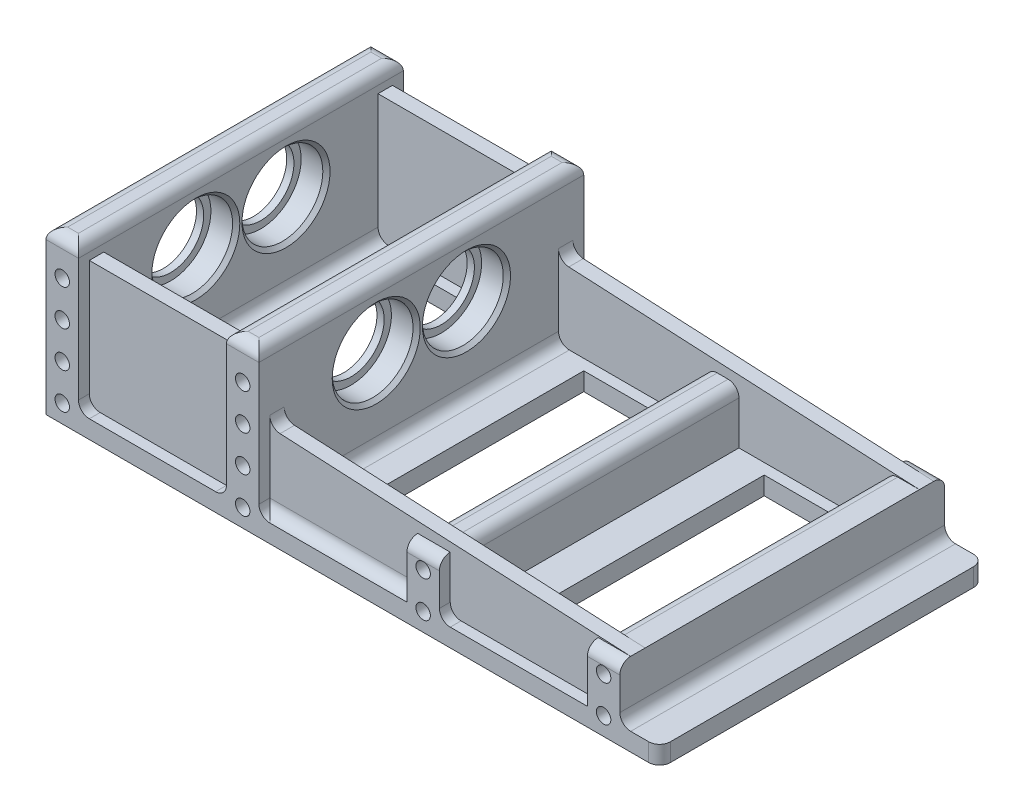
from build123d import *

# Parameters (mm, degrees)
ESQUISSE1_W             = 170
ESQUISSE1_H             = 90
BOSS_EXTRU_1_DEPTH      = 5
ESQUISSE2_W             = 9
ESQUISSE2_H             = 90
BOSS_EXTRU_2_DEPTH      = 40
ESQUISSE3_R             = 11.2
ENL_V_MAT_EXTRU_2_DEPTH = 22.5
ESQUISSE3_4_R           = 11.2
ENL_V_MAT_EXTRU_3_DEPTH = 178.842727722
ESQUISSE5_W             = 21
ESQUISSE5_H             = 70
ENL_V_MAT_EXTRU_4_DEPTH = 129.791553366
ESQUISSE18_W            = 9
ESQUISSE18_H            = 90
BOSS_EXTRU_8_DEPTH      = 15
NERVURE4_REACH          = 145.371
ESQUISSE10_WALL_W       = 388.86681577
ESQUISSE10_WALL_H       = 4
NERVURE5_REACH          = 145.371
ESQUISSE11_WALL_W       = 329.741893798
ESQUISSE11_WALL_H       = 4
NERVURE6_REACH          = 145.371
ESQUISSE12_WALL_W       = 329.741893798
ESQUISSE12_WALL_H       = 4
NERVURE7_REACH          = 145.371
ESQUISSE13_WALL_W       = 329.818042594
ESQUISSE13_WALL_H       = 4
NERVURE8_REACH          = 145.371
ESQUISSE15_WALL_W       = 388.86681577
ESQUISSE15_WALL_H       = 4
NERVURE9_REACH          = 145.371
ESQUISSE14_WALL_W       = 329.741893798
ESQUISSE14_WALL_H       = 4
CONG_25_R               = 3
CHANFREIN1_SIZE         = 1
ESQUISSE16_R            = 11.2
ESQUISSE16_R_2          = 9.2
BOSS_EXTRU_5_DEPTH      = 2
BOSS_EXTRU_7_START      = -50
ESQUISSE16_2_R          = 11.2
ESQUISSE16_2_R_2        = 9.2
BOSS_EXTRU_7_DEPTH      = 2
ESQUISSE17_R            = 2
ENL_V_MAT_EXTRU_5_DEPTH = 20
ENL_V_START             = -70
ESQUISSE17_2_R          = 2
ENL_V_MAT_EXTRU_6_DEPTH = 20


with BuildPart() as part:
    # Esquisse1 → Boss.-Extru.1 (new body)
    with BuildSketch(Plane(origin=(0, 0, 0), x_dir=(1, 0, 0), z_dir=(0, 1, 0))):
        with Locations((21.326047677, 15.679780847)):
            Rectangle(ESQUISSE1_W, ESQUISSE1_H)
    extrude(amount=BOSS_EXTRU_1_DEPTH)

    # Esquisse2 → Boss.-Extru.2 (add)
    with BuildSketch(Plane(origin=(0, 5, 0), x_dir=(1, 0, 0), z_dir=(0, 1, 0))):
        with Locations((-59.173952323, 15.679780847)):
            Rectangle(ESQUISSE2_W, ESQUISSE2_H)
        with Locations((-9.173952323, 15.679780847)):
            Rectangle(ESQUISSE2_W, ESQUISSE2_H)
    extrude(amount=BOSS_EXTRU_2_DEPTH)

    # Esquisse3 → Enlèv. mat.-Extru.2 (cut)
    with BuildSketch(Plane(origin=(-54.673952323, 0, 0), x_dir=(0, 0, -1), z_dir=(1, 0, 0))):
        with Locations((3.179780847, 28)):
            Circle(ESQUISSE3_R)
        with Locations((28.179780847, 28)):
            Circle(ESQUISSE3_R)
    extrude(amount=-ENL_V_MAT_EXTRU_2_DEPTH, mode=Mode.SUBTRACT)

    # Esquisse3<4> → Enlèv. mat.-Extru.3 (cut, through all)
    with BuildSketch(Plane(origin=(-54.673952323, 0, 0), x_dir=(0, 0, -1), z_dir=(1, 0, 0))):
        with Locations((3.179780847, 28)):
            Circle(ESQUISSE3_4_R)
        with Locations((28.179780847, 28)):
            Circle(ESQUISSE3_4_R)
    extrude(amount=ENL_V_MAT_EXTRU_3_DEPTH, mode=Mode.SUBTRACT)

    # Esquisse5 → Enlèv. mat.-Extru.4 (cut, through all)
    with BuildSketch(Plane(origin=(0, 5, 0), x_dir=(1, 0, 0), z_dir=(0, 1, 0))):
        with Locations((-34.173952323, 15.679780847)):
            Rectangle(ESQUISSE5_W, ESQUISSE5_H)
        with Locations((15.826047677, 15.679780847)):
            Rectangle(ESQUISSE5_W, ESQUISSE5_H)
        with Locations((65.826047677, 15.679780847)):
            Rectangle(ESQUISSE5_W, ESQUISSE5_H)
    extrude(amount=-ENL_V_MAT_EXTRU_4_DEPTH, mode=Mode.SUBTRACT)

    # Esquisse18 → Boss.-Extru.8 (add)
    with BuildSketch(Plane(origin=(0, 5, 0), x_dir=(1, 0, 0), z_dir=(0, 1, 0))):
        with Locations((90.826047677, 15.679780847)):
            Rectangle(ESQUISSE18_W, ESQUISSE18_H)
        with Locations((40.826047677, 15.679780847)):
            Rectangle(ESQUISSE18_W, ESQUISSE18_H)
    extrude(amount=BOSS_EXTRU_8_DEPTH)

    # Esquisse10 wall → Nervure4 (add, up to next)
    with BuildSketch(Plane(origin=(45.326047677, 22.5, -55.679780847), x_dir=(0.998752338878, -0.049937616944, 0), z_dir=(-0.049937616944, -0.998752338878, 0)), mode=Mode.PRIVATE) as nervure4_sk1:
        Rectangle(ESQUISSE10_WALL_W, ESQUISSE10_WALL_H)
    nervure4_tool1 = extrude(nervure4_sk1.sketch, amount=NERVURE4_REACH, mode=Mode.PRIVATE) - part.part
    add(nervure4_tool1.solids().sort_by_distance((45.326047677, 22.5, -55.679780847))[0])

    # Esquisse11 wall → Nervure5 (add, up to next)
    with BuildSketch(Plane(origin=(-34.173952323, 25, -55.679780847), x_dir=(1, 0, 0), z_dir=(0, -1, 0)), mode=Mode.PRIVATE) as nervure5_sk1:
        Rectangle(ESQUISSE11_WALL_W, ESQUISSE11_WALL_H)
    nervure5_tool1 = extrude(nervure5_sk1.sketch, amount=NERVURE5_REACH, mode=Mode.PRIVATE) - part.part
    add(nervure5_tool1.solids().sort_by_distance((-34.173952323, 25, -55.679780847))[0])

    # Esquisse12 wall → Nervure6 (add, up to next)
    with BuildSketch(Plane(origin=(-34.173952323, 40, -55.679780847), x_dir=(1, 0, 0), z_dir=(0, -1, 0)), mode=Mode.PRIVATE) as nervure6_sk1:
        Rectangle(ESQUISSE12_WALL_W, ESQUISSE12_WALL_H)
    nervure6_tool1 = extrude(nervure6_sk1.sketch, amount=NERVURE6_REACH, mode=Mode.PRIVATE) - part.part
    add(nervure6_tool1.solids().sort_by_distance((-34.173952323, 40, -55.679780847))[0])

    # Esquisse13 wall → Nervure7 (add, up to next)
    with BuildSketch(Plane(origin=(-34.173952323, 23.75, 24.320219153), x_dir=(0.998146155389, -0.060862570451, 0), z_dir=(0.060862570451, 0.998146155389, 0)), mode=Mode.PRIVATE) as nervure7_sk1:
        Rectangle(ESQUISSE13_WALL_W, ESQUISSE13_WALL_H)
    nervure7_tool1 = extrude(nervure7_sk1.sketch, amount=-NERVURE7_REACH, mode=Mode.PRIVATE) - part.part
    add(nervure7_tool1.solids().sort_by_distance((-34.173952323, 23.75, 24.320219153))[0])

    # Esquisse15 wall → Nervure8 (add, up to next)
    with BuildSketch(Plane(origin=(45.326047677, 22.5, 24.320219153), x_dir=(0.998752338878, -0.049937616944, 0), z_dir=(0.049937616944, 0.998752338878, 0)), mode=Mode.PRIVATE) as nervure8_sk1:
        Rectangle(ESQUISSE15_WALL_W, ESQUISSE15_WALL_H)
    nervure8_tool1 = extrude(nervure8_sk1.sketch, amount=-NERVURE8_REACH, mode=Mode.PRIVATE) - part.part
    add(nervure8_tool1.solids().sort_by_distance((45.326047677, 22.5, 24.320219153))[0])

    # Esquisse14 wall → Nervure9 (add, up to next)
    with BuildSketch(Plane(origin=(-34.173952323, 40, 24.320219153), x_dir=(1, 0, 0), z_dir=(0, 1, 0)), mode=Mode.PRIVATE) as nervure9_sk1:
        Rectangle(ESQUISSE14_WALL_W, ESQUISSE14_WALL_H)
    nervure9_tool1 = extrude(nervure9_sk1.sketch, amount=-NERVURE9_REACH, mode=Mode.PRIVATE) - part.part
    add(nervure9_tool1.solids().sort_by_distance((-34.173952323, 40, 24.320219153))[0])

    # Congé25
    cong_25_edges = [part.edges().sort_by_distance(p)[0] for p in [
        (-59.173952323, 45, -60.679780847),
        (-9.173952323, 45, -60.679780847),
        (40.826047677, 20, -60.679780847),
        (90.826047677, 20, -60.679780847),
        (106.326047677, 2.5, -60.679780847),
        (-54.673952323, 5, -15.679780847),
        (-13.673952323, 5, -15.679780847),
        (-54.673952323, 5, 27.820219153),
        (-13.673952323, 5, 27.820219153),
        (-44.673952323, 2.5, 19.320219153),
        (-4.673952323, 5, -15.679780847),
        (15.826047677, 5, 22.320219153),
        (86.326047677, 20, -15.679780847),
        (45.326047677, 20, -15.679780847),
        (36.326047677, 20, -15.679780847),
        (-4.673952323, 25, -55.679780847),
        (15.826047677, 5, -57.679780847),
        (-4.673952323, 25, 24.320219153),
        (15.826047677, 5, 26.320219153),
        (-4.673952323, 5, 27.820219153),
        (40.826047677, 20, 29.320219153),
        (45.326047677, 5, 27.820219153),
        (90.826047677, 20, 29.320219153),
        (106.326047677, 2.5, 29.320219153),
        (-9.173952323, 45, 29.320219153),
        (-59.173952323, 45, 29.320219153),
        (95.326047677, 5, -15.679780847),
        (86.326047677, 5, -59.179780847),
        (36.326047677, 5, -59.179780847),
        (-4.673952323, 5, -59.179780847),
        (-4.673952323, 45, -15.679780847),
        (-13.673952323, 45, -15.679780847),
        (-13.673952323, 5, -59.179780847),
        (-54.673952323, 5, -59.179780847),
        (-54.673952323, 45, -15.679780847),
        (-63.673952323, 45, -15.679780847),
    ]]
    fillet(cong_25_edges, radius=CONG_25_R - 0.0001)  # a hair under: the kernel refuses the full size

    # Chanfrein1
    chanfrein1_edges = [part.edges().sort_by_distance(p)[0] for p in [
        (-54.673952323, 28, 8.020219153),
        (-54.673952323, 28, -16.979780847),
        (-4.673952323, 28, 8.020219153),
        (-4.673952323, 28, -16.979780847),
    ]]
    chamfer(chanfrein1_edges, length=CHANFREIN1_SIZE)

    # Esquisse16 → Boss.-Extru.5 (add)
    # profile 1 of 2: a face of its own
    with BuildSketch(Plane.ZY.offset(63.673952323)):
        with Locations(Location((-28.179780847, 28, 0), (0, 0, 180))):
            Circle(ESQUISSE16_R)
        with Locations((-28.179780847, 28)):
            Circle(ESQUISSE16_R_2, mode=Mode.SUBTRACT)
    # profile 2 of 2: a face of its own
    with BuildSketch(Plane.ZY.offset(63.673952323)):
        with Locations(Location((-3.179780847, 28, 0), (0, 0, 180))):
            Circle(ESQUISSE16_R)
        with Locations((-3.179780847, 28)):
            Circle(ESQUISSE16_R_2, mode=Mode.SUBTRACT)
    extrude(amount=-BOSS_EXTRU_5_DEPTH)

    # Esquisse16<2> → Boss.-Extru.7 (add)
    # profile 1 of 2: a face of its own
    with BuildSketch(Plane.ZY.offset(63.673952323).offset(BOSS_EXTRU_7_START)):
        with Locations((-28.179780847, 28)):
            Circle(ESQUISSE16_2_R)
        with Locations((-28.179780847, 28)):
            Circle(ESQUISSE16_2_R_2, mode=Mode.SUBTRACT)
    # profile 2 of 2: a face of its own
    with BuildSketch(Plane.ZY.offset(63.673952323).offset(BOSS_EXTRU_7_START)):
        with Locations((-3.179780847, 28)):
            Circle(ESQUISSE16_2_R)
        with Locations((-3.179780847, 28)):
            Circle(ESQUISSE16_2_R_2, mode=Mode.SUBTRACT)
    extrude(amount=-BOSS_EXTRU_7_DEPTH)

    # Esquisse17 → Enlèv. mat.-Extru.5 (cut)
    with BuildSketch(Plane.XY.offset(29.320219153)):
        with Locations((-59.173952323, 5)):
            Circle(ESQUISSE17_R)
        with Locations((-9.173952323, 5)):
            Circle(ESQUISSE17_R)
        with Locations((-9.173952323, 15)):
            Circle(ESQUISSE17_R)
        with Locations((-9.173952323, 25)):
            Circle(ESQUISSE17_R)
        with Locations((-9.173952323, 35)):
            Circle(ESQUISSE17_R)
        with Locations((-59.173952323, 15)):
            Circle(ESQUISSE17_R)
        with Locations((-59.173952323, 25)):
            Circle(ESQUISSE17_R)
        with Locations((-59.173952323, 35)):
            Circle(ESQUISSE17_R)
        with Locations((40.826047677, 5)):
            Circle(ESQUISSE17_R)
        with Locations((90.826047677, 5)):
            Circle(ESQUISSE17_R)
        with Locations((40.826047677, 15)):
            Circle(ESQUISSE17_R)
        with Locations((90.826047677, 15)):
            Circle(ESQUISSE17_R)
        with Locations((40.826047677, 25)):
            Circle(ESQUISSE17_R)
        with Locations((90.826047677, 25)):
            Circle(ESQUISSE17_R)
        with Locations((40.826047677, 35)):
            Circle(ESQUISSE17_R)
        with Locations((90.826047677, 35)):
            Circle(ESQUISSE17_R)
    extrude(amount=-ENL_V_MAT_EXTRU_5_DEPTH, mode=Mode.SUBTRACT)

    # Esquisse17<2> → Enlèv. mat.-Extru.6 (cut)
    with BuildSketch(Plane.XY.offset(29.320219153).offset(ENL_V_START)):
        with Locations((-59.173952323, 5)):
            Circle(ESQUISSE17_2_R)
        with Locations((-9.173952323, 5)):
            Circle(ESQUISSE17_2_R)
        with Locations((-9.173952323, 15)):
            Circle(ESQUISSE17_2_R)
        with Locations((-9.173952323, 25)):
            Circle(ESQUISSE17_2_R)
        with Locations((-9.173952323, 35)):
            Circle(ESQUISSE17_2_R)
        with Locations((-59.173952323, 15)):
            Circle(ESQUISSE17_2_R)
        with Locations((-59.173952323, 25)):
            Circle(ESQUISSE17_2_R)
        with Locations((-59.173952323, 35)):
            Circle(ESQUISSE17_2_R)
        with Locations((40.826047677, 5)):
            Circle(ESQUISSE17_2_R)
        with Locations((90.826047677, 5)):
            Circle(ESQUISSE17_2_R)
        with Locations((40.826047677, 15)):
            Circle(ESQUISSE17_2_R)
        with Locations((90.826047677, 15)):
            Circle(ESQUISSE17_2_R)
        with Locations((40.826047677, 25)):
            Circle(ESQUISSE17_2_R)
        with Locations((90.826047677, 25)):
            Circle(ESQUISSE17_2_R)
        with Locations((40.826047677, 35)):
            Circle(ESQUISSE17_2_R)
        with Locations((90.826047677, 35)):
            Circle(ESQUISSE17_2_R)
    extrude(amount=-ENL_V_MAT_EXTRU_6_DEPTH, mode=Mode.SUBTRACT)


solid = part.part
